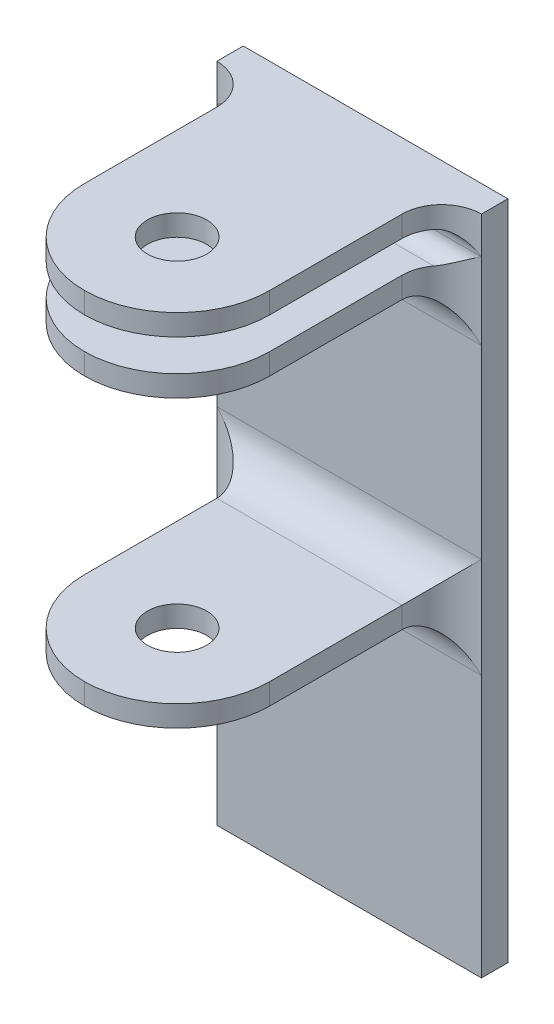
from build123d import *

# Parameters (mm, degrees)
ESQUISSE1_W             = 250
ESQUISSE1_H             = 100
BOSS_EXTRU_1_DEPTH      = 10
ESQUISSE2_W             = 70
ESQUISSE2_H             = 8
BOSS_EXTRU_2_DEPTH      = 100
CONG_1_R                = 35
ESQUISSE3_R             = 11.2
ENL_V_MAT_EXTRU_1_DEPTH = 150
CONG_2_R                = 15
CONG_3_R                = 6


with BuildPart() as part:
    # Esquisse1 → Boss.-Extru.1 (new body)
    with BuildSketch(Plane(origin=(0, 0, 0), x_dir=(0, 1, 0), z_dir=(0, 0, 1))):
        with Locations((125, 50)):
            Rectangle(ESQUISSE1_W, ESQUISSE1_H)
    extrude(amount=BOSS_EXTRU_1_DEPTH)

    # Esquisse2 → Boss.-Extru.2 (add)
    with BuildSketch(Plane.XY.offset(10)):
        with Locations((-50, 226)):
            Rectangle(ESQUISSE2_W, ESQUISSE2_H)
        with Locations((-50, 246)):
            Rectangle(ESQUISSE2_W, ESQUISSE2_H)
        with Locations((-50, 118)):
            Rectangle(ESQUISSE2_W, ESQUISSE2_H)
    extrude(amount=BOSS_EXTRU_2_DEPTH)

    # Congé1
    cong_1_edges = [part.edges().sort_by_distance(p)[0] for p in [
        (-85, 226, 110),
        (-15, 226, 110),
        (-15, 118, 110),
        (-85, 118, 110),
        (-85, 246, 110),
        (-15, 246, 110),
    ]]
    fillet(cong_1_edges, radius=CONG_1_R - 0.0001)  # a hair under: the kernel refuses the full size

    # Esquisse3 → Enlèv. mat.-Extru.1 (cut)
    with BuildSketch(Plane(origin=(0, 250, 0), x_dir=(-1, 0, 0), z_dir=(0, 1, 0))):
        with Locations(Location((50, 75, 0), (0, 0, 90))):
            Circle(ESQUISSE3_R)
    extrude(amount=-ENL_V_MAT_EXTRU_1_DEPTH, mode=Mode.SUBTRACT)

    # Congé2
    cong_2_edges = [part.edges().sort_by_distance(p)[0] for p in [
        (-15, 118, 10),
        (-50, 122, 10),
        (-85, 118, 10),
        (-50, 114, 10),
        (-85, 246, 10),
        (-15, 246, 10),
        (-15, 226, 10),
        (-50, 222, 10),
        (-85, 226, 10),
    ]]
    fillet(cong_2_edges, radius=CONG_2_R - 0.0001)  # a hair under: the kernel refuses the full size

    # Congé3
    cong_3_edges = [part.edges().sort_by_distance(p)[0] for p in [
        (-50, 242, 10),
        (-50, 230, 10),
    ]]
    fillet(cong_3_edges, radius=CONG_3_R - 0.0001)  # a hair under: the kernel refuses the full size


solid = part.part
